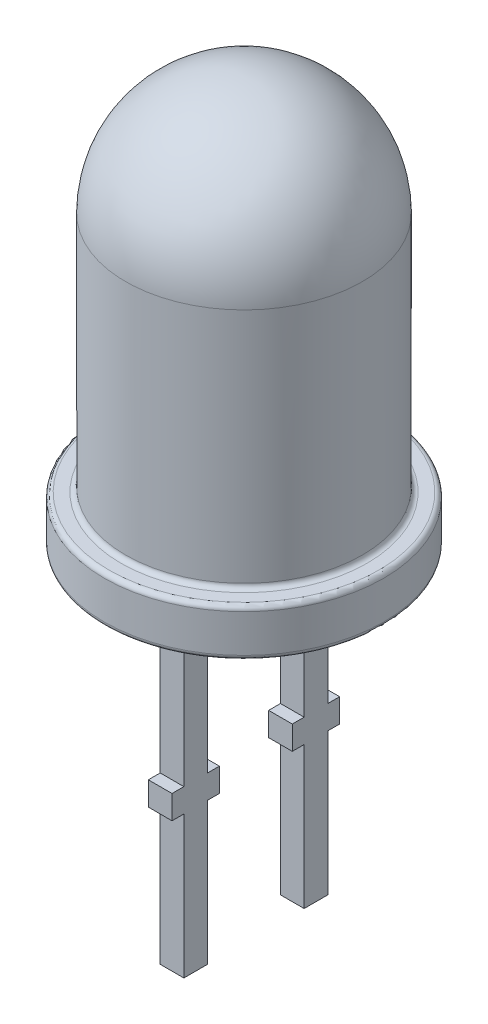
from build123d import *

# Parameters (mm, degrees)
EXTRUDE_1_DEPTH        = 0.25
EXTRUDE_1_DEPTH_BACK   = 0.25
EXTRUDE_1_2_DEPTH      = 0.25
EXTRUDE_1_2_DEPTH_BACK = 0.25
SKETCH_4_W             = 0.2
SKETCH_4_H             = 0.2
EXTRUDE_2_DEPTH        = 0.05
SKETCH_6_R             = 0.02
FILLET_1_R             = 0.1
FILLET_2_R             = 0.1


with BuildPart() as part:
    # Эскиз1 → Бобышка-Вытянуть1 (new, two sides: drawn at the far end of the back side and taken through both)
    with BuildSketch(Plane(origin=(0, 0, 0), x_dir=(0, 0, -1), z_dir=(1, 0, 0)).offset(-EXTRUDE_1_DEPTH_BACK)):
        with BuildLine():
            Line((-1.52, 4), (-1.52, 0.5))
            Line((-1.52, 0.5), (-1.77, 0.5))
            Line((-1.77, 0.5), (-1.77, 0))
            Line((-1.77, 0), (-1.52, 0))
            Line((-1.52, 0), (-1.52, -3))
            Line((-1.52, -3), (-1.02, -3))
            Line((-1.02, -3), (-1.02, 0))
            Line((-1.02, 0), (-0.77, 0))
            Line((-0.77, 0), (-0.77, 0.5))
            Line((-0.77, 0.5), (-1.02, 0.5))
            Line((-1.02, 0.5), (-1.02, 4))
            Line((-1.02, 4), (-1.02, 4.5))
            ThreePointArc((-1.02, 4.5), (-0.990710678, 4.570710678), (-0.92, 4.6))
            Line((-0.92, 4.6), (-0.27, 4.6))
            ThreePointArc((-0.27, 4.6), (-0.199289322, 4.629289322), (-0.17, 4.7))
            Line((-0.17, 4.7), (-0.17, 5.9))
            ThreePointArc((-0.17, 5.9), (-0.140710678, 5.970710678), (-0.07, 6))
            Line((-0.07, 6), (0.03, 6))
            ThreePointArc((0.03, 6), (0.100710678, 6.029289322), (0.13, 6.1))
            Line((0.13, 6.1), (0.13, 6.240775729))
            ThreePointArc((0.13, 6.240775729), (0.117315088, 6.289520734), (0.08247849, 6.325899216))
            Line((0.08247849, 6.325899216), (-1.036542981, 7.015774117))
            ThreePointArc((-1.036542981, 7.015774117), (-1.071379579, 7.052152599), (-1.084064491, 7.100897604))
            Line((-1.084064491, 7.100897604), (-1.084064491, 8.1))
            Line((-1.084064491, 8.1), (-1.7066193, 8.1))
            Line((-1.7066193, 8.1), (-1.7066193, 6.800897604))
            ThreePointArc((-1.7066193, 6.800897604), (-1.693934388, 6.752152599), (-1.65909779, 6.715774117))
            Line((-1.65909779, 6.715774117), (-1.26752151, 6.474367982))
            ThreePointArc((-1.26752151, 6.474367982), (-1.232684912, 6.4379895), (-1.22, 6.389244495))
            Line((-1.22, 6.389244495), (-1.22, 6.05))
            ThreePointArc((-1.22, 6.05), (-1.230557281, 6.00527864), (-1.26, 5.97))
            Line((-1.26, 5.97), (-1.78, 5.58))
            ThreePointArc((-1.78, 5.58), (-1.809442719, 5.54472136), (-1.82, 5.5))
            Line((-1.82, 5.5), (-1.82, 4.3))
            ThreePointArc((-1.82, 4.3), (-1.790710678, 4.229289322), (-1.72, 4.2))
            Line((-1.72, 4.2), (-1.62, 4.2))
            ThreePointArc((-1.62, 4.2), (-1.549289322, 4.170710678), (-1.52, 4.1))
            Line((-1.52, 4.1), (-1.52, 4))
        make_face()
    extrude(amount=EXTRUDE_1_DEPTH + EXTRUDE_1_DEPTH_BACK)



with BuildPart() as body_2:
    # Эскиз1 → Extrude 1 2 (new, two sides: drawn at the far end of the back side and taken through both)
    with BuildSketch(Plane(origin=(0, 0, 0), x_dir=(0, 0, -1), z_dir=(1, 0, 0)).offset(-EXTRUDE_1_2_DEPTH_BACK)):
        with BuildLine():
            Line((1.02, 4), (1.02, 0.5))
            Line((1.02, 0.5), (0.77, 0.5))
            Line((0.77, 0.5), (0.77, 0))
            Line((0.77, 0), (1.02, 0))
            Line((1.02, 0), (1.02, -3))
            Line((1.02, -3), (1.52, -3))
            Line((1.52, -3), (1.52, 0))
            Line((1.52, 0), (1.77, 0))
            Line((1.77, 0), (1.77, 0.5))
            Line((1.77, 0.5), (1.52, 0.5))
            Line((1.52, 0.5), (1.52, 4))
            Line((1.52, 4), (1.52, 4.1))
            ThreePointArc((1.52, 4.1), (1.549289322, 4.170710678), (1.62, 4.2))
            Line((1.62, 4.2), (1.72, 4.2))
            ThreePointArc((1.72, 4.2), (1.790710678, 4.229289322), (1.82, 4.3))
            Line((1.82, 4.3), (1.82, 5.176393202))
            ThreePointArc((1.82, 5.176393202), (1.817324899, 5.199368494), (1.809442719, 5.221114562))
            Line((1.809442719, 5.221114562), (1.36472136, 6.110557281))
            ThreePointArc((1.36472136, 6.110557281), (1.359295749, 6.186901417), (1.409442719, 6.24472136))
            Line((1.409442719, 6.24472136), (1.754863459, 6.417431729))
            ThreePointArc((1.754863459, 6.417431729), (1.79520718, 6.454301337), (1.810142099, 6.506874449))
            Line((1.810142099, 6.506874449), (1.810142099, 8))
            Line((1.810142099, 8), (-0.789857901, 8))
            Line((-0.789857901, 8), (-0.789857901, 7.400897604))
            ThreePointArc((-0.789857901, 7.400897604), (-0.777172988, 7.352152599), (-0.742336391, 7.315774117))
            Line((-0.742336391, 7.315774117), (0.62247849, 6.474367982))
            ThreePointArc((0.62247849, 6.474367982), (0.657315088, 6.4379895), (0.67, 6.389244495))
            Line((0.67, 6.389244495), (0.67, 5.15936331))
            ThreePointArc((0.67, 5.15936331), (0.684010113, 5.108316867), (0.722114787, 5.071573753))
            Line((0.722114787, 5.071573753), (1.102671606, 4.863997306))
            ThreePointArc((1.102671606, 4.863997306), (1.153765317, 4.790461608), (1.125497071, 4.705497071))
            Line((1.125497071, 4.705497071), (1.049289322, 4.629289322))
            ThreePointArc((1.049289322, 4.629289322), (1.027612047, 4.596846987), (1.02, 4.558578644))
            Line((1.02, 4.558578644), (1.02, 4))
        make_face()
    extrude(amount=EXTRUDE_1_2_DEPTH + EXTRUDE_1_2_DEPTH_BACK)

    # Эскиз2 → Повернуть2 (revolve)
    with BuildSketch(Plane(origin=(0, 0, 0), x_dir=(0, 0, -1), z_dir=(1, 0, 0))):
        Polygon((0, 8.001193103), (-0.6, 8.001193103), (-0.6, 7.801193103), (0, 7.001193103), align=None)
    revolve(axis=Axis((0, 0, 0), (0, 1, 0)))

    # Эскиз3 → Вырез-Повернуть1 (revolve, cut)
    with BuildSketch(Plane(origin=(0, 0, 0), x_dir=(0, 0, -1), z_dir=(1, 0, 0))):
        Polygon((0, 8.00470677), (0.55, 8.00470677), (0.55, 7.99470677), (0.15, 7.90470677), (0, 7.90470677), align=None)
    revolve(axis=Axis((0, -8.975718179, 0), (0, 1, 0)), mode=Mode.SUBTRACT)

    # Эскиз4 → Бобышка-Вытянуть2 (add)
    with BuildSketch(Plane(origin=(0, 7.90470677, 0), x_dir=(1, 0, 0), z_dir=(0, 1, 0))):
        Rectangle(SKETCH_4_W, SKETCH_4_H)
    extrude(amount=EXTRUDE_2_DEPTH)


with BuildPart() as part_1:
    add(part.part)

    add(body_2.part)  # По траектории1 merges body 2
    # По траектории1: sweep along a curve in space
    with BuildLine() as sweep_1_path:
        Line((0, 7.95470677, 0), (0, 7.967341926, 0))
        ThreePointArc((0, 7.967341926, 0), (0, 7.997272592, 0.009948093), (0, 8.015293136, 0.035833789))
        Line((0, 8.163044316, 0.535956778), (0, 8.015293136, 0.035833789))
        ThreePointArc((0, 8.163044316, 0.535956778), (0, 8.195467515, 0.701510243), (0, 8.196425892, 0.870206109))
        Line((0, 8.154031095, 1.349745092), (0, 8.196425892, 0.870206109))
        ThreePointArc((0, 8.104225354, 1.395341896), (0, 8.137988056, 1.382221157), (0, 8.154031095, 1.349745092))
        Line((0, 8.1, 1.395341896), (0, 8.104225354, 1.395341896))
    # Эскиз6 → По траектории1 (sweep)
    with BuildSketch(Plane(origin=(0, 7.95470677, 0), x_dir=(1, 0, 0), z_dir=(0, 1, 0))):
        Circle(SKETCH_6_R)
    sweep(path=sweep_1_path.line)

    # Эскиз7 → Повернуть3 (revolve)
    with BuildSketch(Plane(origin=(0, 0, 0), x_dir=(0, 0, -1), z_dir=(1, 0, 0))):
        with BuildLine():
            Line((0, 4), (2.95, 4))
            Line((2.95, 4), (2.95, 5))
            Line((2.95, 5), (2.5, 5))
            Line((2.5, 5), (2.5, 10.1))
            ThreePointArc((2.5, 10.1), (1.767766953, 11.867766953), (0, 12.6))
            Line((0, 12.6), (0, 12.502462568))
            ThreePointArc((0, 12.502462568), (1.698797574, 11.798797574), (2.402462568, 10.1))
            Line((2.402462568, 10.1), (2.402462568, 4.9))
            Line((2.402462568, 4.9), (2.85, 4.9))
            Line((2.85, 4.9), (2.85, 4.1))
            Line((2.85, 4.1), (0, 4.1))
            Line((0, 4.1), (0, 4))
        make_face()
    revolve(axis=Axis((0, 0, 0), (0, 1, 0)))

    # Скругление1
    fillet_1_edges = [part_1.edges().sort_by_distance(p)[0] for p in [
        (0, 5, 2.5),
        (0, 4, 2.95),
        (0, 5, 2.95),
    ]]
    fillet(fillet_1_edges, radius=FILLET_1_R)

    # Скругление2
    fillet_2_edges = [part_1.edges().sort_by_distance(p)[0] for p in [
        (0, 4, 1.02),
        (0, 4, 1.52),
        (0.25, 4, 1.27),
        (-0.25, 4, 1.27),
        (0, 4, -1.52),
        (-0.25, 4, -1.27),
        (0, 4, -1.02),
        (0.25, 4, -1.27),
    ]]
    fillet(fillet_2_edges, radius=FILLET_2_R)


solid = part_1.part
